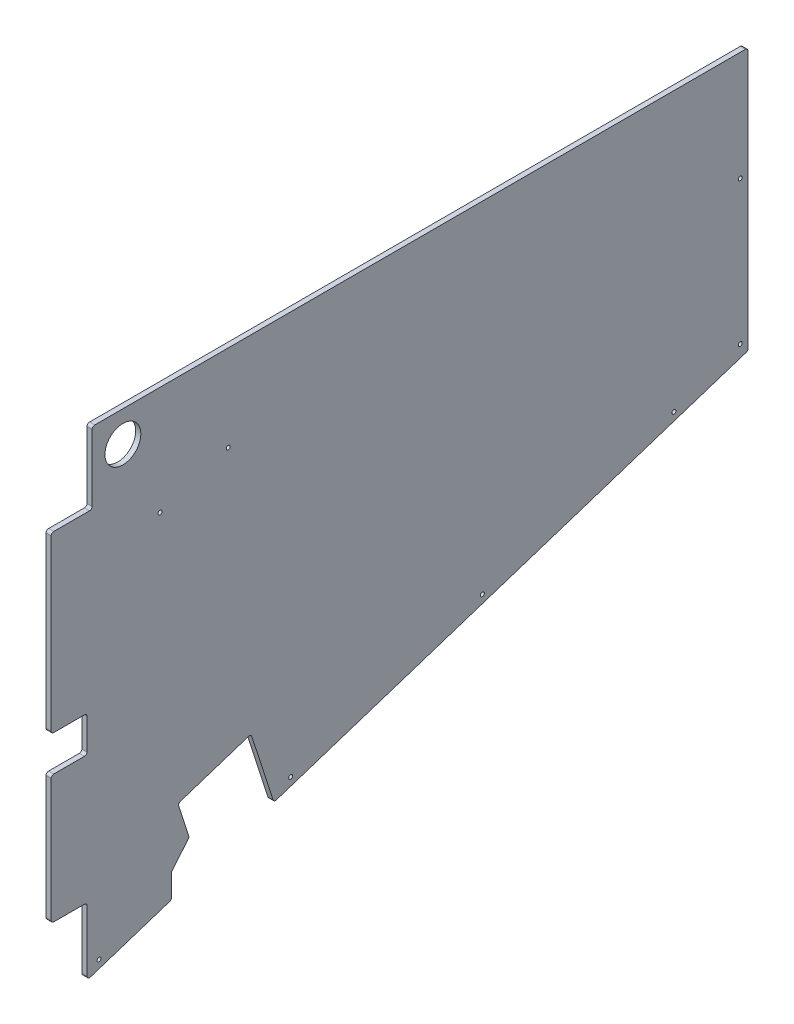
from build123d import *

# Parameters (mm, degrees)
BOSS_EXTRUDE1_DEPTH = 6.35
SKETCH2_R           = 2.45745
SKETCH2_R_2         = 22.225
SKETCH2_W           = 44.45
SKETCH2_H           = 44.45
CUT_EXTRUDE1_DEPTH  = 1236.054594947
FILLET1_R           = 3.175


with BuildPart() as part:
    # Sketch1 → Boss-Extrude1 (new body)
    with BuildSketch(Plane(origin=(0, 0, 0), x_dir=(0, 0, -1), z_dir=(1, 0, 0))):
        Polygon((1016, 533.4), (1066.8, 533.4), (1066.8, 0), (0, 0), (0, 533.4), (50.8, 533.4), (50.8, 622.3), (1016, 622.3), align=None)
    extrude(amount=BOSS_EXTRUDE1_DEPTH)

    # Sketch2 → Cut-Extrude1 (cut, through all)
    with BuildSketch(Plane(origin=(6.35, 0, 0), x_dir=(0, 0, -1), z_dir=(1, 0, 0))):
        with Locations((59.31154, 45.87748)):
            Circle(SKETCH2_R)
        with Locations((296.845703608, 123.057008284)):
            Circle(SKETCH2_R)
        with Locations((534.379867216, 200.236536569)):
            Circle(SKETCH2_R)
        with Locations((771.922083103, 277.418681197)):
            Circle(SKETCH2_R)
        with Locations((854.075, 309.0545)):
            Circle(SKETCH2_R)
        with Locations((854.075, 486.8545)):
            Circle(SKETCH2_R)
        with Locations((219.486424299, 515.220524995)):
            Circle(SKETCH2_R)
        with Locations((134.9375, 487.748914195)):
            Circle(SKETCH2_R)
        with Locations((88.9, 584.2)):
            Circle(SKETCH2_R_2)
        Polygon((149.225, 95.25), (171.033618902, 121.240499926), (157.061866823, 164.241131286), (247.65, 193.675), (276.045265579, 106.283358593), (863.6, 297.191464421), (863.6, 622.3), (1016, 622.3), (1016, 533.4), (1066.8, 533.4), (1066.8, 0), (0, 0), (0, 114.3), (44.45, 114.3), (44.45, 31.033495252), (149.225, 65.076956425), align=None)
        with Locations((22.225, 295.275)):
            Rectangle(SKETCH2_W, SKETCH2_H)
    extrude(amount=-CUT_EXTRUDE1_DEPTH, mode=Mode.SUBTRACT)

    # Fillet1
    fillet1_edges = [part.edges().sort_by_distance(p)[0] for p in [
        (3.175, 164.241131286, -157.061866823),
        (3.175, 193.675, -247.65),
        (3.175, 121.240499926, -171.033618902),
        (3.175, 95.25, -149.225),
        (3.175, 533.4, 0),
        (3.175, 533.4, -50.8),
        (3.175, 622.3, -50.8),
        (3.175, 622.3, -863.6),
        (3.175, 114.3, -44.45),
        (3.175, 114.3, 0),
        (3.175, 106.283358593, -276.045265579),
        (3.175, 297.191464421, -863.6),
        (3.175, 65.076956425, -149.225),
        (3.175, 31.033495252, -44.45),
        (3.175, 317.5, 0),
        (3.175, 317.5, -44.45),
        (3.175, 273.05, -44.45),
        (3.175, 273.05, 0),
    ]]
    fillet(fillet1_edges, radius=FILLET1_R)


solid = part.part
